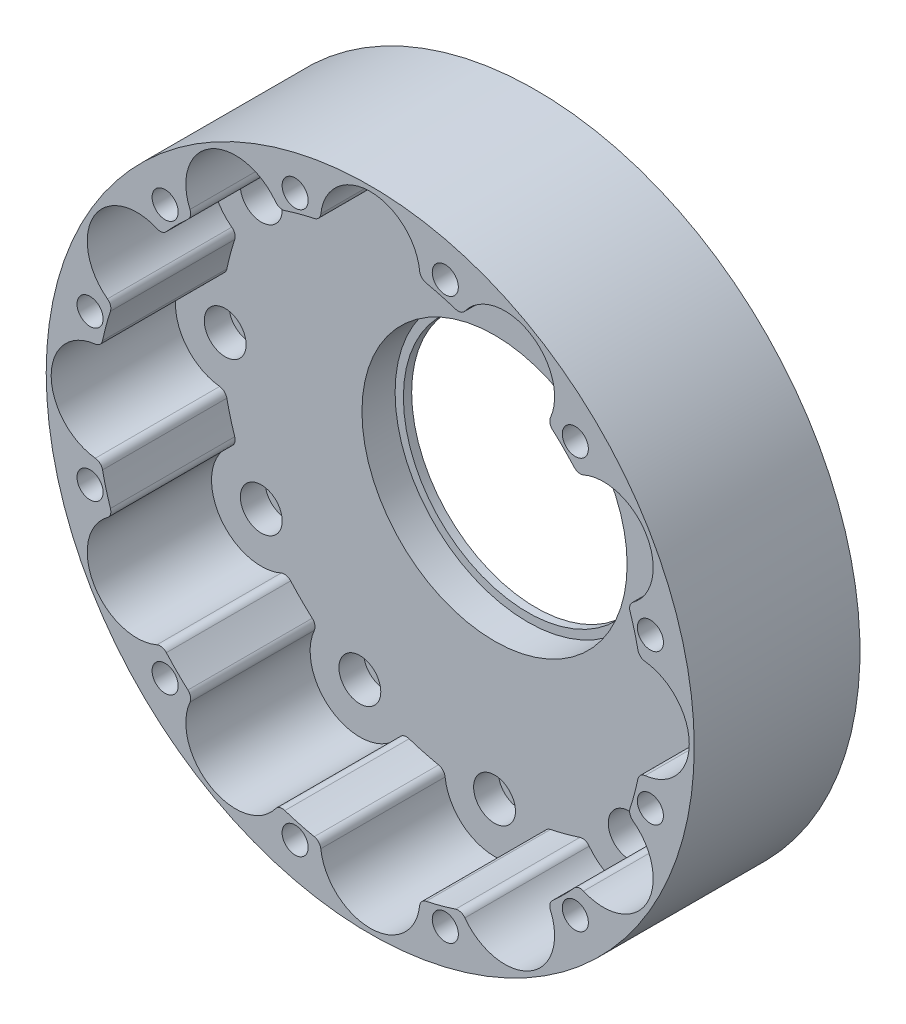
from build123d import *
from build123d.topology import SkipClean

# Parameters (mm, degrees)
SKETCH1_R           = 39.1
SKETCH1_R_2         = 2.525
SKETCH1_R_3         = 16
BOSS_EXTRUDE1_DEPTH = 3
BOSS_EXTRUDE2_START = 2
SKETCH2_R           = 39.1
SKETCH2_R_2         = 16
BOSS_EXTRUDE2_DEPTH = 2
SKETCH4_R           = 16
SKETCH4_R_2         = 15
BOSS_EXTRUDE3_DEPTH = 1
SKETCH5_R           = 39.1
BOSS_EXTRUDE4_DEPTH = 15
FILLET2_R           = 1
SKETCH7_R           = 1.575
CUT_EXTRUDE1_DEPTH  = 59.801530759
CUT_EXTRUDE3_DEPTH  = 3


with BuildPart() as part:
    # Sketch1 → Boss-Extrude1 (new body)
    with BuildSketch(Plane.XY):
        Circle(SKETCH1_R)
        with Locations((32.5, 0)):
            Circle(SKETCH1_R_2, mode=Mode.SUBTRACT)
        with Locations((28.145825623, -16.25)):
            Circle(SKETCH1_R_2, mode=Mode.SUBTRACT)
        with Locations((16.25, -28.145825623)):
            Circle(SKETCH1_R_2, mode=Mode.SUBTRACT)
        with Locations((0, -32.5)):
            Circle(SKETCH1_R_2, mode=Mode.SUBTRACT)
        with Locations((-16.25, -28.145825623)):
            Circle(SKETCH1_R_2, mode=Mode.SUBTRACT)
        with Locations((-28.145825623, -16.25)):
            Circle(SKETCH1_R_2, mode=Mode.SUBTRACT)
        with Locations((-32.5, 0)):
            Circle(SKETCH1_R_2, mode=Mode.SUBTRACT)
        with Locations((-28.145825623, 16.25)):
            Circle(SKETCH1_R_2, mode=Mode.SUBTRACT)
        with Locations((-16.25, 28.145825623)):
            Circle(SKETCH1_R_2, mode=Mode.SUBTRACT)
        with Locations((0, 32.5)):
            Circle(SKETCH1_R_2, mode=Mode.SUBTRACT)
        with Locations((16.25, 28.145825623)):
            Circle(SKETCH1_R_2, mode=Mode.SUBTRACT)
        Circle(SKETCH1_R_3, mode=Mode.SUBTRACT)
        with Locations((28.145825623, 16.25)):
            Circle(SKETCH1_R_2, mode=Mode.SUBTRACT)
    extrude(amount=BOSS_EXTRUDE1_DEPTH)

    # Sketch2 → Boss-Extrude2 (add)
    with BuildSketch(Plane(origin=(0, 0, 0), x_dir=(-1, 0, 0), z_dir=(0, 0, -1)).offset(BOSS_EXTRUDE2_START)):
        Circle(SKETCH2_R)
        Circle(SKETCH2_R_2, mode=Mode.SUBTRACT)
    extrude(amount=-BOSS_EXTRUDE2_DEPTH)

    # Sketch4 → Boss-Extrude3 (add)
    with SkipClean():  # the faces are left unmerged after this step: merging them gives an invalid solid
        with BuildSketch(Plane(origin=(0, 0, -2), x_dir=(-1, 0, 0), z_dir=(0, 0, -1))):
            Circle(SKETCH4_R)
            Circle(SKETCH4_R_2, mode=Mode.SUBTRACT)
        extrude(amount=-BOSS_EXTRUDE3_DEPTH)

    # Sketch5 → Boss-Extrude4 (add)
    with BuildSketch(Plane.XY.offset(3)):
        Circle(SKETCH5_R)
        with BuildLine():
            ThreePointArc((-21.420971998, 25.102628521), (-19.25, 33.341978046), (-11.029028002, 31.102420184))
            ThreePointArc((-11.029028002, 31.102420184), (-8.541028488, 31.875552268), (-5.999791663, 32.45))
            ThreePointArc((-5.999791663, 32.45), (0, 38.5), (5.999791663, 32.45))
            ThreePointArc((5.999791663, 32.45), (8.541028488, 31.875552268), (11.029028002, 31.102420184))
            ThreePointArc((11.029028002, 31.102420184), (19.25, 33.341978046), (21.420971998, 25.102628521))
            ThreePointArc((21.420971998, 25.102628521), (23.334523779, 23.334523779), (25.102628521, 21.420971998))
            ThreePointArc((25.102628521, 21.420971998), (33.341978046, 19.25), (31.102420184, 11.029028002))
            ThreePointArc((31.102420184, 11.029028002), (31.875552268, 8.541028488), (32.45, 5.999791663))
            ThreePointArc((32.45, 5.999791663), (38.5, 0), (32.45, -5.999791663))
            ThreePointArc((32.45, -5.999791663), (31.875552268, -8.541028488), (31.102420184, -11.029028002))
            ThreePointArc((31.102420184, -11.029028002), (33.341978046, -19.25), (25.102628521, -21.420971998))
            ThreePointArc((25.102628521, -21.420971998), (23.334523779, -23.334523779), (21.420971998, -25.102628521))
            ThreePointArc((21.420971998, -25.102628521), (19.25, -33.341978046), (11.029028002, -31.102420184))
            ThreePointArc((11.029028002, -31.102420184), (8.541028488, -31.875552268), (5.999791663, -32.45))
            ThreePointArc((5.999791663, -32.45), (0, -38.5), (-5.999791663, -32.45))
            ThreePointArc((-5.999791663, -32.45), (-8.541028488, -31.875552268), (-11.029028002, -31.102420184))
            ThreePointArc((-11.029028002, -31.102420184), (-19.25, -33.341978046), (-21.420971998, -25.102628521))
            ThreePointArc((-21.420971998, -25.102628521), (-23.334523779, -23.334523779), (-25.102628521, -21.420971998))
            ThreePointArc((-25.102628521, -21.420971998), (-33.341978046, -19.25), (-31.102420184, -11.029028002))
            ThreePointArc((-31.102420184, -11.029028002), (-31.875552268, -8.541028488), (-32.45, -5.999791663))
            ThreePointArc((-32.45, -5.999791663), (-38.5, 0), (-32.45, 5.999791663))
            ThreePointArc((-32.45, 5.999791663), (-31.875552268, 8.541028488), (-31.102420184, 11.029028002))
            ThreePointArc((-31.102420184, 11.029028002), (-33.341978046, 19.25), (-25.102628521, 21.420971998))
            ThreePointArc((-25.102628521, 21.420971998), (-23.334523779, 23.334523779), (-21.420971998, 25.102628521))
        make_face(mode=Mode.SUBTRACT)
    extrude(amount=BOSS_EXTRUDE4_DEPTH)

    # Fillet2
    fillet2_edges = [part.edges().sort_by_distance(p)[0] for p in [
        (11.029028002, -31.102420184, 10.5),
        (5.999791663, -32.45, 10.5),
        (32.45, -5.999791663, 10.5),
        (31.102420184, -11.029028002, 10.5),
        (25.102628521, -21.420971998, 10.5),
        (21.420971998, -25.102628521, 10.5),
        (-11.029028002, -31.102420184, 10.5),
        (-5.999791663, -32.45, 10.5),
        (-21.420971998, -25.102628521, 10.5),
        (-25.102628521, -21.420971998, 10.5),
        (-32.45, -5.999791663, 10.5),
        (-31.102420184, -11.029028002, 10.5),
        (-21.420971998, 25.102628521, 10.5),
        (32.45, 5.999791663, 10.5),
        (31.102420184, 11.029028002, 10.5),
        (25.102628521, 21.420971998, 10.5),
        (21.420971998, 25.102628521, 10.5),
        (11.029028002, 31.102420184, 10.5),
        (5.999791663, 32.45, 10.5),
        (-5.999791663, 32.45, 10.5),
        (-11.029028002, 31.102420184, 10.5),
        (-32.45, 5.999791663, 10.5),
        (-31.102420184, 11.029028002, 10.5),
        (-25.102628521, 21.420971998, 10.5),
    ]]
    fillet(fillet2_edges, radius=FILLET2_R)

    # Sketch7 → Cut-Extrude1 (cut, through all)
    with BuildSketch(Plane(origin=(0, 0, -2), x_dir=(-1, 0, 0), z_dir=(0, 0, -1))):
        with Locations((33.80740392, -9.058666579)):
            Circle(SKETCH7_R)
        with Locations((24.748737342, -24.748737342)):
            Circle(SKETCH7_R)
        with Locations((9.058666579, -33.80740392)):
            Circle(SKETCH7_R)
        with Locations((-9.058666579, -33.80740392)):
            Circle(SKETCH7_R)
        with Locations((-24.748737342, -24.748737342)):
            Circle(SKETCH7_R)
        with Locations((-33.80740392, -9.058666579)):
            Circle(SKETCH7_R)
        with Locations((-33.80740392, 9.058666579)):
            Circle(SKETCH7_R)
        with Locations((-24.748737342, 24.748737342)):
            Circle(SKETCH7_R)
        with Locations((-9.058666579, 33.80740392)):
            Circle(SKETCH7_R)
        with Locations((9.058666579, 33.80740392)):
            Circle(SKETCH7_R)
        with Locations((24.748737342, 24.748737342)):
            Circle(SKETCH7_R)
        with Locations((33.80740392, 9.058666579)):
            Circle(SKETCH7_R)
    extrude(amount=-CUT_EXTRUDE1_DEPTH, mode=Mode.SUBTRACT)

    # Sketch8 → Cut-Extrude3 (cut)
    with BuildSketch(Plane(origin=(0, 0, -2), x_dir=(-1, 0, 0), z_dir=(0, 0, -1))):
        Polygon((27.598737342, -26.394185609), (27.598737342, -23.103289074), (24.748737342, -21.457840807), (21.898737342, -23.103289074), (21.898737342, -26.394185609), (24.748737342, -28.039633876), align=None)
        Polygon((37.098300454, -9.058666579), (35.452852187, -6.208666579), (32.161955653, -6.208666579), (30.516507386, -9.058666579), (32.161955653, -11.908666579), (35.452852187, -11.908666579), align=None)
        Polygon((10.704114846, -36.65740392), (12.349563113, -33.80740392), (10.704114846, -30.95740392), (7.413218311, -30.95740392), (5.767770044, -33.80740392), (7.413218311, -36.65740392), align=None)
        Polygon((-9.058666579, -37.098300454), (-6.208666579, -35.452852187), (-6.208666579, -32.161955653), (-9.058666579, -30.516507386), (-11.908666579, -32.161955653), (-11.908666579, -35.452852187), align=None)
        Polygon((-26.394185609, -27.598737342), (-23.103289074, -27.598737342), (-21.457840807, -24.748737342), (-23.103289074, -21.898737342), (-26.394185609, -21.898737342), (-28.039633876, -24.748737342), align=None)
        Polygon((-36.65740392, -10.704114846), (-33.80740392, -12.349563113), (-30.95740392, -10.704114846), (-30.95740392, -7.413218311), (-33.80740392, -5.767770044), (-36.65740392, -7.413218311), align=None)
        Polygon((-37.098300454, 9.058666579), (-35.452852187, 6.208666579), (-32.161955653, 6.208666579), (-30.516507386, 9.058666579), (-32.161955653, 11.908666579), (-35.452852187, 11.908666579), align=None)
        Polygon((-27.598737342, 26.394185609), (-27.598737342, 23.103289074), (-24.748737342, 21.457840807), (-21.898737342, 23.103289074), (-21.898737342, 26.394185609), (-24.748737342, 28.039633876), align=None)
        Polygon((-10.704114846, 36.65740392), (-12.349563113, 33.80740392), (-10.704114846, 30.95740392), (-7.413218311, 30.95740392), (-5.767770044, 33.80740392), (-7.413218311, 36.65740392), align=None)
        Polygon((9.058666579, 37.098300454), (6.208666579, 35.452852187), (6.208666579, 32.161955653), (9.058666579, 30.516507386), (11.908666579, 32.161955653), (11.908666579, 35.452852187), align=None)
        Polygon((26.394185609, 27.598737342), (23.103289074, 27.598737342), (21.457840807, 24.748737342), (23.103289074, 21.898737342), (26.394185609, 21.898737342), (28.039633876, 24.748737342), align=None)
        Polygon((36.65740392, 10.704114846), (33.80740392, 12.349563113), (30.95740392, 10.704114846), (30.95740392, 7.413218311), (33.80740392, 5.767770044), (36.65740392, 7.413218311), align=None)
    extrude(amount=-CUT_EXTRUDE3_DEPTH, mode=Mode.SUBTRACT)


solid = part.part
